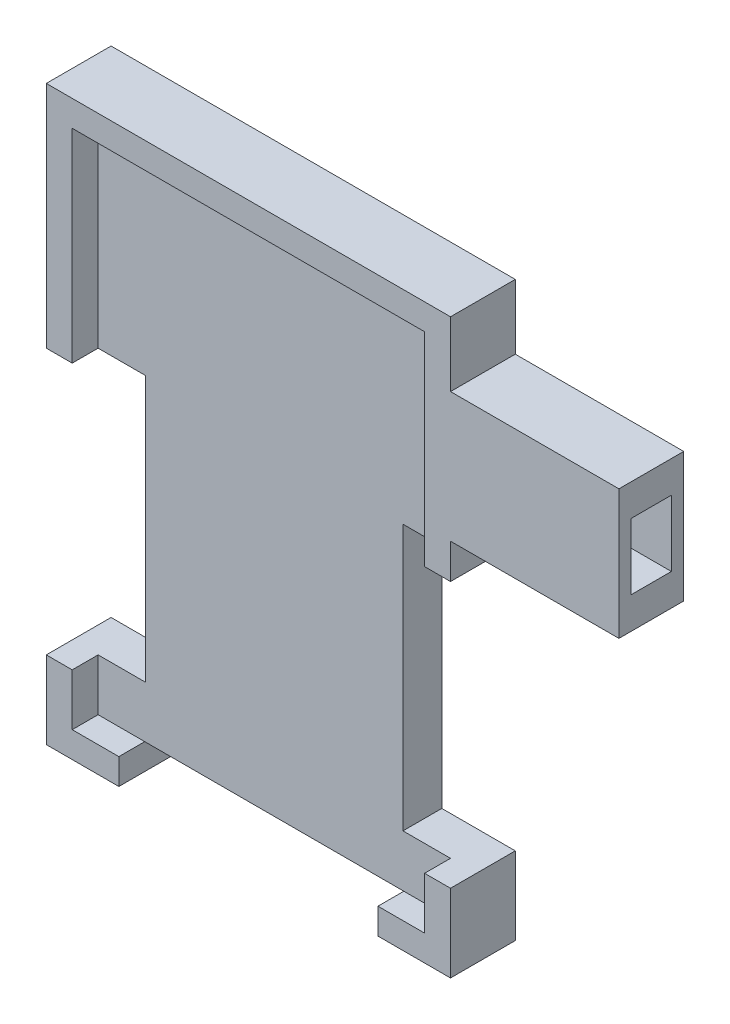
from build123d import *

# Parameters (mm, degrees)
BOSS_EXTRUDE1_DEPTH = 3
BOSS_EXTRUDE2_DEPTH = 5
SKETCH1_4_W         = 13
SKETCH1_4_H         = 10
BOSS_EXTRUDE3_DEPTH = 5
SKETCH2_W           = 3.1
SKETCH2_H           = 5.1
CUT_EXTRUDE1_DEPTH  = 6


with BuildPart() as part:
    # Sketch1 → Boss-Extrude1 (new body)
    with BuildSketch(Plane.XY):
        Polygon((9.93, 4.4), (13.6, 4.4), (13.6, 20.1), (-13.6, 20.1), (-13.6, 4.4), (-9.93, 4.4), (-9.93, -16.1), (-13.6, -16.1), (-13.6, -20.1), (-10, -20.1), (10, -20.1), (13.6, -20.1), (13.6, -16.1), (9.93, -16.1), align=None)
    extrude(amount=BOSS_EXTRUDE1_DEPTH)

    # Sketch1<3> → Boss-Extrude2 (add)
    with BuildSketch(Plane.XY):
        Polygon((15.6, 4.4), (15.6, 22.1), (-15.6, 22.1), (-15.6, 4.4), (-13.6, 4.4), (-13.6, 20.1), (13.6, 20.1), (13.6, 4.4), align=None)
        Polygon((15.6, -22.1), (15.6, -16.1), (13.6, -16.1), (13.6, -20.1), (10, -20.1), (10, -22.1), align=None)
        Polygon((-13.6, -16.1), (-15.6, -16.1), (-15.6, -22.1), (-10, -22.1), (-10, -20.1), (-13.6, -20.1), align=None)
    extrude(amount=BOSS_EXTRUDE2_DEPTH)

    # Sketch1<4> → Boss-Extrude3 (add)
    with BuildSketch(Plane.XY):
        with Locations((22.1, 12.1)):
            Rectangle(SKETCH1_4_W, SKETCH1_4_H)
    extrude(amount=BOSS_EXTRUDE3_DEPTH)

    # Sketch2 → Cut-Extrude1 (cut)
    with BuildSketch(Plane(origin=(28.6, 0, 0), x_dir=(0, 0, -1), z_dir=(1, 0, 0))):
        with Locations((-2.5, 12.1)):
            Rectangle(SKETCH2_W, SKETCH2_H)
    extrude(amount=-CUT_EXTRUDE1_DEPTH, mode=Mode.SUBTRACT)


solid = part.part
